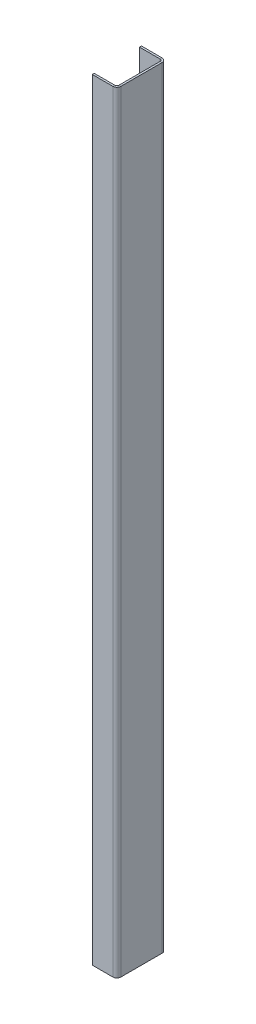
from build123d import *

# Parameters (mm, degrees)
BASE_FLANGE1_DEPTH = 596.9


# Sheet-metal steps are written as plain solids
with BuildPart() as part:
    # Sketch1 → Base-Flange1 (new, symmetric)
    with BuildSketch(Plane(origin=(0, 0, 0), x_dir=(1, 0, 0), z_dir=(0, 1, 0))):
        with BuildLine():
            Line((-38.1, 38.1), (-6.21284, 38.1))
            ThreePointArc((-6.21284, 38.1), (-1.819698706, 36.280301294), (0, 31.88716))
            Line((0, 31.88716), (0, -31.88716))
            ThreePointArc((0, -31.88716), (-1.819698706, -36.280301294), (-6.21284, -38.1))
            Line((-6.21284, -38.1), (-38.1, -38.1))
            Line((-38.1, -38.1), (-38.1, -35.06216))
            Line((-38.1, -35.06216), (-6.21284, -35.06216))
            ThreePointArc((-6.21284, -35.06216), (-3.96777597, -34.13222403), (-3.03784, -31.88716))
            Line((-3.03784, -31.88716), (-3.03784, 31.88716))
            ThreePointArc((-3.03784, 31.88716), (-3.96777597, 34.13222403), (-6.21284, 35.06216))
            Line((-6.21284, 35.06216), (-38.1, 35.06216))
            Line((-38.1, 35.06216), (-38.1, 38.1))
        make_face()
    extrude(amount=BASE_FLANGE1_DEPTH, both=True)


solid = part.part
